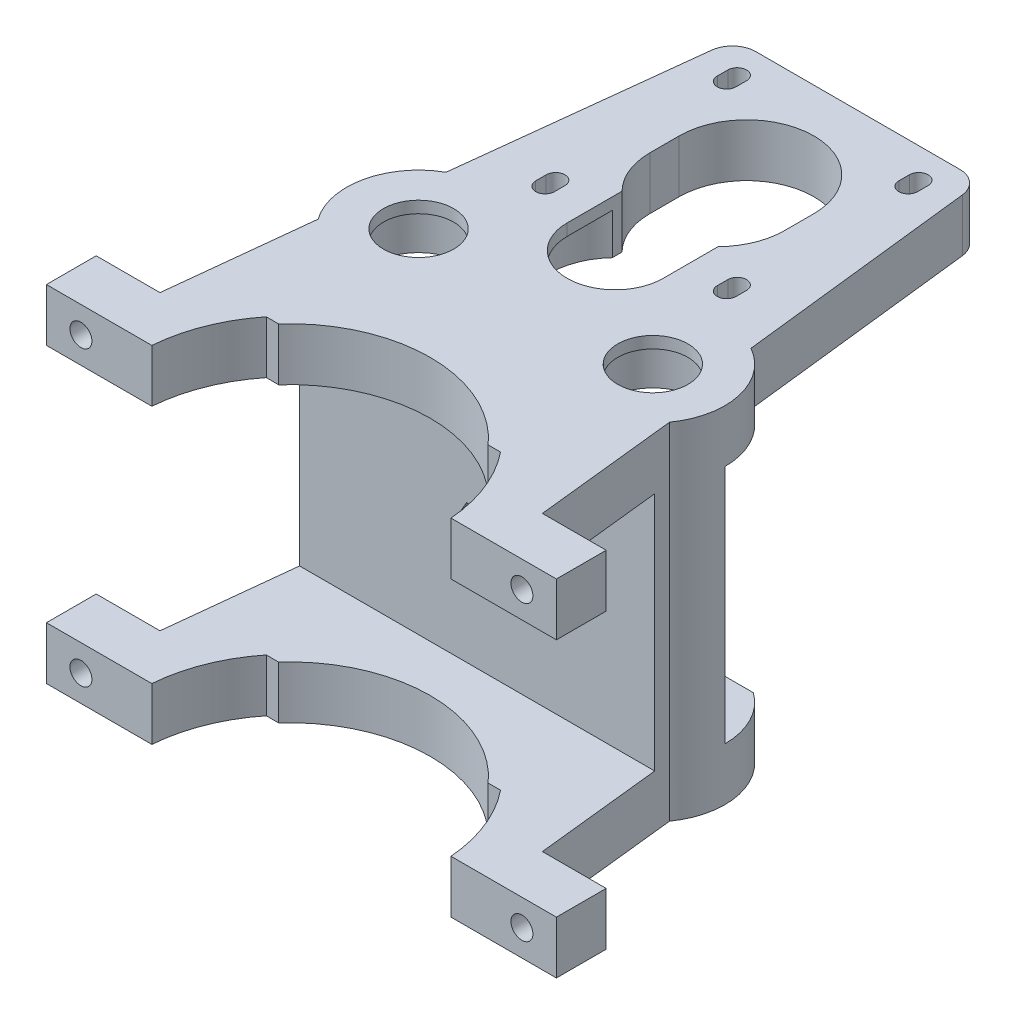
from build123d import *

# Parameters (mm, degrees)
CROQUIS1_R                                        = 6
SALIENTE_EXTRUIR1_DEPTH                           = 4.5
REDONDEO1_R                                       = 4
CROQUIS6_R                                        = 11.25
CORTAR_EXTRUIR1_DEPTH                             = 7
CORTAR_EXTRUIR2_DEPTH                             = 2.8
CROQUIS7_3_R                                      = 1.875
CORTAR_EXTRUIR3_DEPTH                             = 97.941912835
REFRENTADO_START                                  = -4.5
REFRENTADO_PARA_TORNILLO_CON_CABEZA_PLAN_DEPTH    = 9
REFRENTADO_PARA_TORNILLO_CON_CABEZA_3_DEPTH       = 2.2
REFRENTADO_PARA_TORNILLO_CON_CABEZA_4_D           = 1.8
REFRENTADO_PARA_TORNILLO_CON_CABEZA_4_DEPTH       = 10
REFRENTADO_PARA_TORNILLO_CON_CABEZA_4_CBORE_D     = 15.5
REFRENTADO_PARA_TORNILLO_CON_CABEZA_4_CBORE_DEPTH = 7
REFRENTADO_PARA_TORNILLO_CON_CABEZA_4_TIP         = 0.540774557
SALIENTE_EXTRUIR2_DEPTH                           = 50
CORTAR_EXTRUIR4_DEPTH                             = 41
SIMETR_A3_COPY_1_SKETCH_R                         = 1.875
SIMETR_A3_COPY_1_DEPTH                            = 97.941912835
SIMETR_A3_COPY_2_DEPTH                            = 2.8
CROQUIS16_R                                       = 6
SALIENTE_EXTRUIR3_DEPTH                           = 2
SALIENTE_EXTRUIR4_DEPTH                           = 9
CROQUIS18_W                                       = 15.4
CROQUIS18_H                                       = 7
CORTAR_EXTRUIR6_DEPTH                             = 5
CORTAR_EXTRUIR6_DRAFT                             = -5
CORTAR_EXTRUIR8_REACH                             = 123.595
CROQUIS18_5_R                                     = 1.875
CORTAR_EXTRUIR9_DEPTH                             = 89.828398973
CORTAR_EXTRUIR10_DEPTH                            = 2.8


# Read off the part's stored shape, not the designer's step: Refrentado para tornillo con cabeza plana de M1.63
with BuildPart() as part:
    # Croquis1 → Saliente-Extruir1 (new, symmetric)
    with BuildSketch(Plane(origin=(0, 0, 0), x_dir=(1, 0, 0), z_dir=(0, 1, 0))):
        with BuildLine():
            Line((-43.53429067, 2), (-25.53429067, 2))
            ThreePointArc((-25.53429067, 2), (-23.818961075, 9.415789574), (-20, 16))
            Line((-20, 16), (-17.88854382, 16))
            ThreePointArc((-17.88854382, 16), (0, 24), (17.88854382, 16))
            Line((17.88854382, 16), (20, 16))
            ThreePointArc((20, 16), (23.818961075, 9.415789574), (25.53429067, 2))
            Line((25.53429067, 2), (43.53429067, 2))
            Line((43.53429067, 2), (43.53429067, 10.5))
            Line((43.53429067, 10.5), (32.645826686, 10.5))
            Line((32.645826686, 10.5), (30.009064815, 34.850970588))
            ThreePointArc((30.009064815, 34.850970588), (32.006281766, 44.671927797), (26.032635781, 52.719016071))
            Line((26.032635781, 52.719016071), (21, 97))
            Line((21, 97), (-21, 97))
            Line((-21, 97), (-26.026491152, 52.718318152))
            ThreePointArc((-26.026491152, 52.718318152), (-32.00176087, 44.67557015), (-30.00847894, 34.856381245))
            Line((-30.00847894, 34.856381245), (-32.645826686, 10.5))
            Line((-32.645826686, 10.5), (-43.53429067, 10.5))
            Line((-43.53429067, 10.5), (-43.53429067, 2))
        make_face()
        with Locations(Location((-20, 42, 0), (0, 0, 270))):
            Circle(CROQUIS1_R, mode=Mode.SUBTRACT)
        with Locations(Location((20, 42, 0), (0, 0, 270))):
            Circle(CROQUIS1_R, mode=Mode.SUBTRACT)
        with BuildLine():
            ThreePointArc((-8.2, 64.937122102), (-10.643072865, 68.643969697), (-11.5, 73))
            Line((-11.5, 73), (-11.5, 78))
            ThreePointArc((-11.5, 78), (0, 89.5), (11.5, 78))
            Line((11.5, 78), (11.5, 73))
            ThreePointArc((11.5, 73), (10.643072865, 68.643969697), (8.2, 64.937122102))
            Line((8.2, 64.937122102), (8.2, 55.57))
            ThreePointArc((8.2, 55.57), (0, 47.37), (-8.2, 55.57))
            Line((-8.2, 55.57), (-8.2, 64.937122102))
        make_face(mode=Mode.SUBTRACT)
    extrude(amount=SALIENTE_EXTRUIR1_DEPTH, both=True)

    # Redondeo1
    redondeo1_edges = [part.edges().sort_by_distance(p)[0] for p in [
        (-21, 0, -97),
        (21, 0, -97),
    ]]
    fillet(redondeo1_edges, radius=REDONDEO1_R)

    # Croquis6 → Cortar-Extruir1 (cut)
    with BuildSketch(Plane.XZ.offset(4.5)):
        with Locations((0, -55.57)):
            Circle(CROQUIS6_R)
    extrude(amount=-CORTAR_EXTRUIR1_DEPTH, mode=Mode.SUBTRACT)

    # Croquis7 → Cortar-Extruir2 (cut)
    with BuildSketch(Plane(origin=(0, 0, -10.5), x_dir=(-1, 0, 0), z_dir=(0, 0, -1))):
        Polygon((-39.445826686, 3.117691454), (-41.245826686, 0), (-39.445826686, -3.117691454), (-35.845826686, -3.117691454), (-34.045826686, 0), (-35.845826686, 3.117691454), align=None)
    cortar_extruir2 = extrude(amount=-CORTAR_EXTRUIR2_DEPTH, mode=Mode.SUBTRACT)

    # Croquis7<3> → Cortar-Extruir3 (cut, through all)
    with BuildSketch(Plane(origin=(0, 0, -10.5), x_dir=(-1, 0, 0), z_dir=(0, 0, -1))):
        with Locations((-37.645826686, 0)):
            Circle(CROQUIS7_3_R)
    cortar_extruir3 = extrude(amount=-CORTAR_EXTRUIR3_DEPTH, mode=Mode.SUBTRACT)

    # Refrentado para tornillo con cabeza  2 → Refrentado para tornillo con cabeza plan (cut)
    with BuildSketch(Plane(origin=(0, 0, 0), x_dir=(1, 0, 0), z_dir=(0, 1, 0)).offset(REFRENTADO_START)):
        with BuildLine():
            ThreePointArc((17.1, 60.9), (15.5, 62.5), (13.9, 60.9))
            Line((13.9, 60.9), (13.9, 59.1))
            ThreePointArc((13.9, 59.1), (15.5, 57.5), (17.1, 59.1))
            Line((17.1, 59.1), (17.1, 60.9))
        make_face()
        with BuildLine():
            Line((17.1, 90.1), (17.1, 91.9))
            ThreePointArc((17.1, 91.9), (15.5, 93.5), (13.9, 91.9))
            Line((13.9, 91.9), (13.9, 90.1))
            ThreePointArc((13.9, 90.1), (15.5, 88.5), (17.1, 90.1))
        make_face()
        with BuildLine():
            ThreePointArc((-13.9, 60.9), (-15.5, 62.5), (-17.1, 60.9))
            Line((-17.1, 60.9), (-17.1, 59.1))
            ThreePointArc((-17.1, 59.1), (-15.5, 57.5), (-13.9, 59.1))
            Line((-13.9, 59.1), (-13.9, 60.9))
        make_face()
        with BuildLine():
            Line((-13.9, 90.1), (-13.9, 91.9))
            ThreePointArc((-13.9, 91.9), (-15.5, 93.5), (-17.1, 91.9))
            Line((-17.1, 91.9), (-17.1, 90.1))
            ThreePointArc((-17.1, 90.1), (-15.5, 88.5), (-13.9, 90.1))
        make_face()
    extrude(amount=REFRENTADO_PARA_TORNILLO_CON_CABEZA_PLAN_DEPTH, mode=Mode.SUBTRACT)

    # Refrentado para tornillo con cabeza 3 ou → Refrentado para tornillo con cabeza  3 (cut)
    # profile 1 of 4: a face of its own
    with BuildSketch(Plane(origin=(0, 0, 0), x_dir=(1, 0, 0), z_dir=(0, 1, 0)).offset(REFRENTADO_START)):
        with BuildLine():
            ThreePointArc((19.1, 60.9), (15.5, 64.5), (11.9, 60.9))
            Line((11.9, 60.9), (11.9, 59.1))
            ThreePointArc((11.9, 59.1), (15.5, 55.5), (19.1, 59.1))
            Line((19.1, 59.1), (19.1, 60.9))
        make_face()
        with BuildLine():
            Line((13.9, 59.1), (13.9, 60.9))
            ThreePointArc((13.9, 60.9), (15.5, 62.5), (17.1, 60.9))
            Line((17.1, 60.9), (17.1, 59.1))
            ThreePointArc((17.1, 59.1), (15.5, 57.5), (13.9, 59.1))
        make_face(mode=Mode.SUBTRACT)
    # profile 2 of 4: a face of its own
    with BuildSketch(Plane(origin=(0, 0, 0), x_dir=(1, 0, 0), z_dir=(0, 1, 0)).offset(REFRENTADO_START)):
        with BuildLine():
            Line((19.1, 90.1), (19.1, 91.9))
            ThreePointArc((19.1, 91.9), (15.5, 95.5), (11.9, 91.9))
            Line((11.9, 91.9), (11.9, 90.1))
            ThreePointArc((11.9, 90.1), (15.5, 86.5), (19.1, 90.1))
        make_face()
        with BuildLine():
            ThreePointArc((13.9, 91.9), (15.5, 93.5), (17.1, 91.9))
            Line((17.1, 91.9), (17.1, 90.1))
            ThreePointArc((17.1, 90.1), (15.5, 88.5), (13.9, 90.1))
            Line((13.9, 90.1), (13.9, 91.9))
        make_face(mode=Mode.SUBTRACT)
    # profile 3 of 4: a face of its own
    with BuildSketch(Plane(origin=(0, 0, 0), x_dir=(1, 0, 0), z_dir=(0, 1, 0)).offset(REFRENTADO_START)):
        with BuildLine():
            ThreePointArc((-11.9, 60.9), (-15.5, 64.5), (-19.1, 60.9))
            Line((-19.1, 60.9), (-19.1, 59.1))
            ThreePointArc((-19.1, 59.1), (-15.5, 55.5), (-11.9, 59.1))
            Line((-11.9, 59.1), (-11.9, 60.9))
        make_face()
        with BuildLine():
            Line((-17.1, 59.1), (-17.1, 60.9))
            ThreePointArc((-17.1, 60.9), (-15.5, 62.5), (-13.9, 60.9))
            Line((-13.9, 60.9), (-13.9, 59.1))
            ThreePointArc((-13.9, 59.1), (-15.5, 57.5), (-17.1, 59.1))
        make_face(mode=Mode.SUBTRACT)
    # profile 4 of 4: a face of its own
    with BuildSketch(Plane(origin=(0, 0, 0), x_dir=(1, 0, 0), z_dir=(0, 1, 0)).offset(REFRENTADO_START)):
        with BuildLine():
            Line((-11.9, 90.1), (-11.9, 91.9))
            ThreePointArc((-11.9, 91.9), (-15.5, 95.5), (-19.1, 91.9))
            Line((-19.1, 91.9), (-19.1, 90.1))
            ThreePointArc((-19.1, 90.1), (-15.5, 86.5), (-11.9, 90.1))
        make_face()
        with BuildLine():
            ThreePointArc((-17.1, 91.9), (-15.5, 93.5), (-13.9, 91.9))
            Line((-13.9, 91.9), (-13.9, 90.1))
            ThreePointArc((-13.9, 90.1), (-15.5, 88.5), (-17.1, 90.1))
            Line((-17.1, 90.1), (-17.1, 91.9))
        make_face(mode=Mode.SUBTRACT)
    extrude(amount=REFRENTADO_PARA_TORNILLO_CON_CABEZA_3_DEPTH, mode=Mode.SUBTRACT)

    # Refrentado para tornillo con cabeza  4
    with Locations(Plane(origin=(0, -4.5, 0), x_dir=(-1, 0, 0), z_dir=(0, -1, 0))):
        with Locations((-20, 42), (20, 42)):
            CounterBoreHole(REFRENTADO_PARA_TORNILLO_CON_CABEZA_4_D / 2, REFRENTADO_PARA_TORNILLO_CON_CABEZA_4_CBORE_D / 2, REFRENTADO_PARA_TORNILLO_CON_CABEZA_4_CBORE_DEPTH, depth=REFRENTADO_PARA_TORNILLO_CON_CABEZA_4_DEPTH)
            with Locations((0, 0, -(REFRENTADO_PARA_TORNILLO_CON_CABEZA_4_DEPTH + REFRENTADO_PARA_TORNILLO_CON_CABEZA_4_TIP / 2))):  # 118° drill point
                Cone(0, REFRENTADO_PARA_TORNILLO_CON_CABEZA_4_D / 2, REFRENTADO_PARA_TORNILLO_CON_CABEZA_4_TIP, mode=Mode.SUBTRACT)

    # Simetría1: Cortar-Extruir3 across plane
    add(cortar_extruir3.mirror(Plane(origin=(0, 0, 0), x_dir=(0, 0, 1), z_dir=(1, 0, 0))), mode=Mode.SUBTRACT)

    # Simetría2: Cortar-Extruir2 across plane
    add(cortar_extruir2.mirror(Plane(origin=(0, 0, 0), x_dir=(0, 0, 1), z_dir=(1, 0, 0))), mode=Mode.SUBTRACT)

    # Croquis15 → Saliente-Extruir2 (add)
    with BuildSketch(Plane.XZ.offset(4.5)):
        with BuildLine():
            Line((27.75, -42), (32.3, -42))
            ThreePointArc((32.3, -42), (31.713272327, -38.246434843), (30.009064815, -34.850970588))
            Line((30.009064815, -34.850970588), (32.645826686, -10.5))
            Line((32.645826686, -10.5), (43.53429067, -10.5))
            Line((43.53429067, -10.5), (43.53429067, -2))
            Line((43.53429067, -2), (25.53429067, -2))
            ThreePointArc((25.53429067, -2), (23.818961075, -9.415789574), (20, -16))
            Line((20, -16), (17.88854382, -16))
            ThreePointArc((17.88854382, -16), (0, -24), (-17.88854382, -16))
            Line((-17.88854382, -16), (-20, -16))
            ThreePointArc((-20, -16), (-23.818961075, -9.415789574), (-25.53429067, -2))
            Line((-25.53429067, -2), (-43.53429067, -2))
            Line((-43.53429067, -2), (-43.53429067, -10.5))
            Line((-43.53429067, -10.5), (-32.645826686, -10.5))
            Line((-32.645826686, -10.5), (-30.00847894, -34.856381245))
            ThreePointArc((-30.00847894, -34.856381245), (-31.710443867, -38.249474164), (-32.296379126, -42))
            Line((-32.296379126, -42), (-27.75, -42))
            ThreePointArc((-27.75, -42), (-20, -34.25), (-12.25, -42))
            Line((-12.25, -42), (12.25, -42))
            ThreePointArc((12.25, -42), (20, -34.25), (27.75, -42))
        make_face()
    extrude(amount=SALIENTE_EXTRUIR2_DEPTH)

    # Croquis15<3> → Cortar-Extruir4 (cut)
    with BuildSketch(Plane.XZ.offset(4.5)):
        with BuildLine():
            Line((-30.31777245, -32), (30.31777245, -32))
            Line((30.31777245, -32), (32.645826686, -10.5))
            Line((32.645826686, -10.5), (43.53429067, -10.5))
            Line((43.53429067, -10.5), (43.53429067, -2))
            Line((43.53429067, -2), (25.53429067, -2))
            ThreePointArc((25.53429067, -2), (23.818961075, -9.415789574), (20, -16))
            Line((20, -16), (17.88854382, -16))
            ThreePointArc((17.88854382, -16), (0, -24), (-17.88854382, -16))
            Line((-17.88854382, -16), (-20, -16))
            ThreePointArc((-20, -16), (-23.818961075, -9.415789574), (-25.53429067, -2))
            Line((-25.53429067, -2), (-43.53429067, -2))
            Line((-43.53429067, -2), (-43.53429067, -10.5))
            Line((-43.53429067, -10.5), (-32.645826686, -10.5))
            Line((-32.645826686, -10.5), (-30.31777245, -32))
        make_face()
    extrude(amount=CORTAR_EXTRUIR4_DEPTH, mode=Mode.SUBTRACT)

    # Simetría3: Cortar-Extruir2, Cortar-Extruir3 across plane
    add(cortar_extruir2.mirror(Plane(origin=(0, -25, 0), x_dir=(0, 0, 1), z_dir=(0, -1, 0))), mode=Mode.SUBTRACT)
    add(cortar_extruir3.mirror(Plane(origin=(0, -25, 0), x_dir=(0, 0, 1), z_dir=(0, -1, 0))), mode=Mode.SUBTRACT)

    # Simetría3 copy 1 sketch → Simetría3 copy 1 (cut, through all)
    with BuildSketch(Plane(origin=(0, -50, -10.5), x_dir=(1, 0, 0), z_dir=(0, 0, -1))):
        with Locations((-37.645826686, 0)):
            Circle(SIMETR_A3_COPY_1_SKETCH_R)
    extrude(amount=-SIMETR_A3_COPY_1_DEPTH, mode=Mode.SUBTRACT)

    # Simetría3 copy 2 sketch → Simetría3 copy 2 (cut)
    with BuildSketch(Plane(origin=(0, -50, -10.5), x_dir=(1, 0, 0), z_dir=(0, 0, -1))):
        Polygon((-39.445826686, 3.117691454), (-41.245826686, 0), (-39.445826686, -3.117691454), (-35.845826686, -3.117691454), (-34.045826686, 0), (-35.845826686, 3.117691454), align=None)
    extrude(amount=-SIMETR_A3_COPY_2_DEPTH, mode=Mode.SUBTRACT)

    # Croquis16 → Saliente-Extruir3 (add)
    # profile 1 of 2: a face of its own
    with BuildSketch(Plane.XZ.offset(54.5)):
        with BuildLine():
            ThreePointArc((-27.75, -42), (-20, -49.75), (-12.25, -42))
            ThreePointArc((-12.25, -42), (-20, -34.25), (-27.75, -42))
        make_face()
        with Locations(Location((-20, -42, 0), (0, 0, 90))):
            Circle(CROQUIS16_R, mode=Mode.SUBTRACT)
    # profile 2 of 2: a face of its own
    with BuildSketch(Plane.XZ.offset(54.5)):
        with BuildLine():
            ThreePointArc((12.25, -42), (20, -49.75), (27.75, -42))
            ThreePointArc((27.75, -42), (20, -34.25), (12.25, -42))
        make_face()
        with Locations(Location((20, -42, 0), (0, 0, 90))):
            Circle(CROQUIS16_R, mode=Mode.SUBTRACT)
    extrude(amount=-SALIENTE_EXTRUIR3_DEPTH)

    # Croquis16<3> → Saliente-Extruir4 (add)
    with BuildSketch(Plane.XZ.offset(54.5)):
        with BuildLine():
            ThreePointArc((-27.75, -42), (-20, -34.25), (-12.25, -42))
            Line((-12.25, -42), (-7.7, -42))
            ThreePointArc((-7.7, -42), (-16.246434843, -30.286727673), (-30.009064815, -34.850970588))
            Line((-30.009064815, -34.850970588), (-30.00847894, -34.856381245))
            ThreePointArc((-30.00847894, -34.856381245), (-31.710443867, -38.249474164), (-32.296379126, -42))
            Line((-32.296379126, -42), (-27.75, -42))
        make_face()
        with BuildLine():
            Line((-7.7, -42), (-12.25, -42))
            ThreePointArc((-12.25, -42), (-20, -49.75), (-27.75, -42))
            Line((-27.75, -42), (-32.296379126, -42))
            ThreePointArc((-32.296379126, -42), (-31.710443867, -38.249474164), (-30.00847894, -34.856381245))
            Line((-30.00847894, -34.856381245), (-30.009064815, -34.850970588))
            ThreePointArc((-30.009064815, -34.850970588), (-23.753565157, -53.713272327), (-7.7, -42))
        make_face()
        with BuildLine():
            ThreePointArc((-27.75, -42), (-20, -34.25), (-12.25, -42))
            Line((-12.25, -42), (-7.7, -42))
            ThreePointArc((-7.7, -42), (-16.246434843, -30.286727673), (-30.009064815, -34.850970588))
            Line((-30.009064815, -34.850970588), (-30.00847894, -34.856381245))
            ThreePointArc((-30.00847894, -34.856381245), (-31.710443867, -38.249474164), (-32.296379126, -42))
            Line((-32.296379126, -42), (-27.75, -42))
        make_face()
        with BuildLine():
            ThreePointArc((30.009064815, -34.850970588), (16.246434843, -30.286727673), (7.7, -42))
            Line((7.7, -42), (12.25, -42))
            ThreePointArc((12.25, -42), (20, -34.25), (27.75, -42))
            Line((27.75, -42), (32.3, -42))
            ThreePointArc((32.3, -42), (31.713272327, -38.246434843), (30.009064815, -34.850970588))
        make_face()
        with BuildLine():
            ThreePointArc((30.009064815, -34.850970588), (16.246434843, -30.286727673), (7.7, -42))
            Line((7.7, -42), (12.25, -42))
            ThreePointArc((12.25, -42), (20, -34.25), (27.75, -42))
            Line((27.75, -42), (32.3, -42))
            ThreePointArc((32.3, -42), (31.713272327, -38.246434843), (30.009064815, -34.850970588))
        make_face()
        with BuildLine():
            Line((12.25, -42), (7.7, -42))
            ThreePointArc((7.7, -42), (20, -54.3), (32.3, -42))
            Line((32.3, -42), (27.75, -42))
            ThreePointArc((27.75, -42), (20, -49.75), (12.25, -42))
        make_face()
    extrude(amount=-SALIENTE_EXTRUIR4_DEPTH)


with BuildPart() as cortar_extruir6_tool:
    # Croquis18 → Cortar-Extruir6 (with draft: the straight prism first)
    with BuildSketch(Plane(origin=(0, 0, -42), x_dir=(-1, 0, 0), z_dir=(0, 0, -1))):
        with Locations((0, -25)):
            Rectangle(CROQUIS18_W, CROQUIS18_H)
    extrude(amount=-CORTAR_EXTRUIR6_DEPTH)
    # Cortar-Extruir6: the draft: its side faces are tilted about the plane it starts from
    cortar_extruir6_sides = [cortar_extruir6_tool.faces().sort_by_distance(p)[0] for p in [
        (7.7, -25, -39.5),
        (0, -28.5, -39.5),
        (-7.7, -25, -39.5),
        (0, -21.5, -39.5),
    ]]
    draft(cortar_extruir6_sides, Plane(origin=(0, 0, -42), x_dir=(-1, 0, 0), z_dir=(0, 0, -1)), CORTAR_EXTRUIR6_DRAFT)


with BuildPart() as part_1:
    add(part.part)

    # Cortar-Extruir6: cut by cortar_extruir6_tool
    add(cortar_extruir6_tool.part, mode=Mode.SUBTRACT)

    # Croquis20 → Cortar-Extruir8 (cut, up to next)
    with BuildSketch(Plane.XZ.offset(54.5), mode=Mode.PRIVATE) as cortar_extruir8_sk1:
        with BuildLine():
            Line((27.161703708, -52), (12.838296292, -52))
            ThreePointArc((12.838296292, -52), (20, -54.3), (27.161703708, -52))
        make_face()
    cortar_extruir8_tool1 = extrude(cortar_extruir8_sk1.sketch, amount=-CORTAR_EXTRUIR8_REACH, mode=Mode.PRIVATE) & part_1.part
    # Croquis20 → Cortar-Extruir8 (cut, up to next)
    with BuildSketch(Plane.XZ.offset(54.5), mode=Mode.PRIVATE) as cortar_extruir8_sk2:
        with BuildLine():
            Line((-12.838296292, -52), (-27.161703708, -52))
            ThreePointArc((-27.161703708, -52), (-20, -54.3), (-12.838296292, -52))
        make_face()
    cortar_extruir8_tool2 = extrude(cortar_extruir8_sk2.sketch, amount=-CORTAR_EXTRUIR8_REACH, mode=Mode.PRIVATE) & part_1.part
    add(cortar_extruir8_tool1.solids().sort_by_distance((20, -54.5, -52.927796))[0], mode=Mode.SUBTRACT)
    add(cortar_extruir8_tool2.solids().sort_by_distance((-20, -54.5, -52.927796))[0], mode=Mode.SUBTRACT)

    # Croquis18<5> → Cortar-Extruir9 (cut, through all)
    with BuildSketch(Plane(origin=(0, 0, -42), x_dir=(-1, 0, 0), z_dir=(0, 0, -1))):
        with Locations((0, -25)):
            Circle(CROQUIS18_5_R)
    extrude(amount=-CORTAR_EXTRUIR9_DEPTH, mode=Mode.SUBTRACT)

    # Croquis21 → Cortar-Extruir10 (cut)
    with BuildSketch(Plane.XY.offset(-32)):
        Polygon((1.8, -28.117691454), (3.6, -25), (1.8, -21.882308546), (-1.8, -21.882308546), (-3.6, -25), (-1.8, -28.117691454), align=None)
    extrude(amount=-CORTAR_EXTRUIR10_DEPTH, mode=Mode.SUBTRACT)


solid = part_1.part
